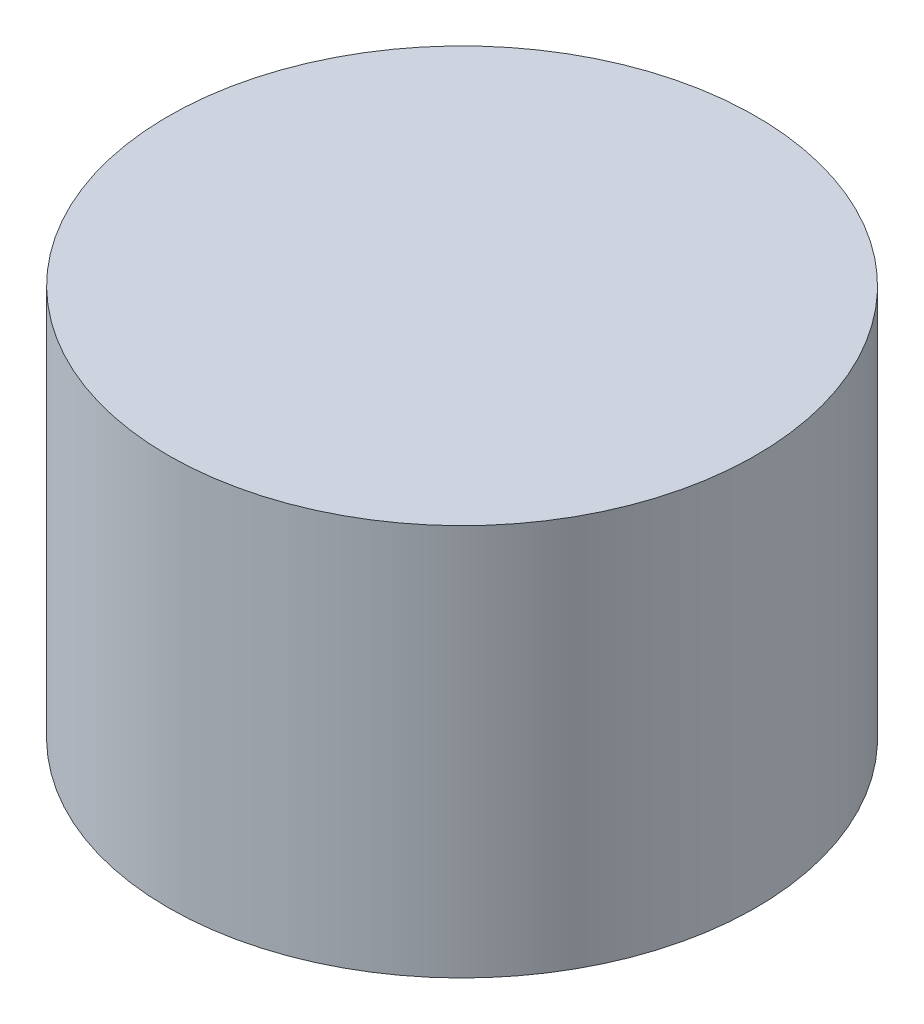
from build123d import *

# Parameters (mm, degrees)
SKETCH1_R   = 24
MOTOR_DEPTH = 32


with BuildPart() as part:
    # Sketch1 → Motor (new body)
    with BuildSketch(Plane(origin=(0, 0, 0), x_dir=(1, 0, 0), z_dir=(0, 1, 0))):
        Circle(SKETCH1_R)
    extrude(amount=MOTOR_DEPTH)


solid = part.part
